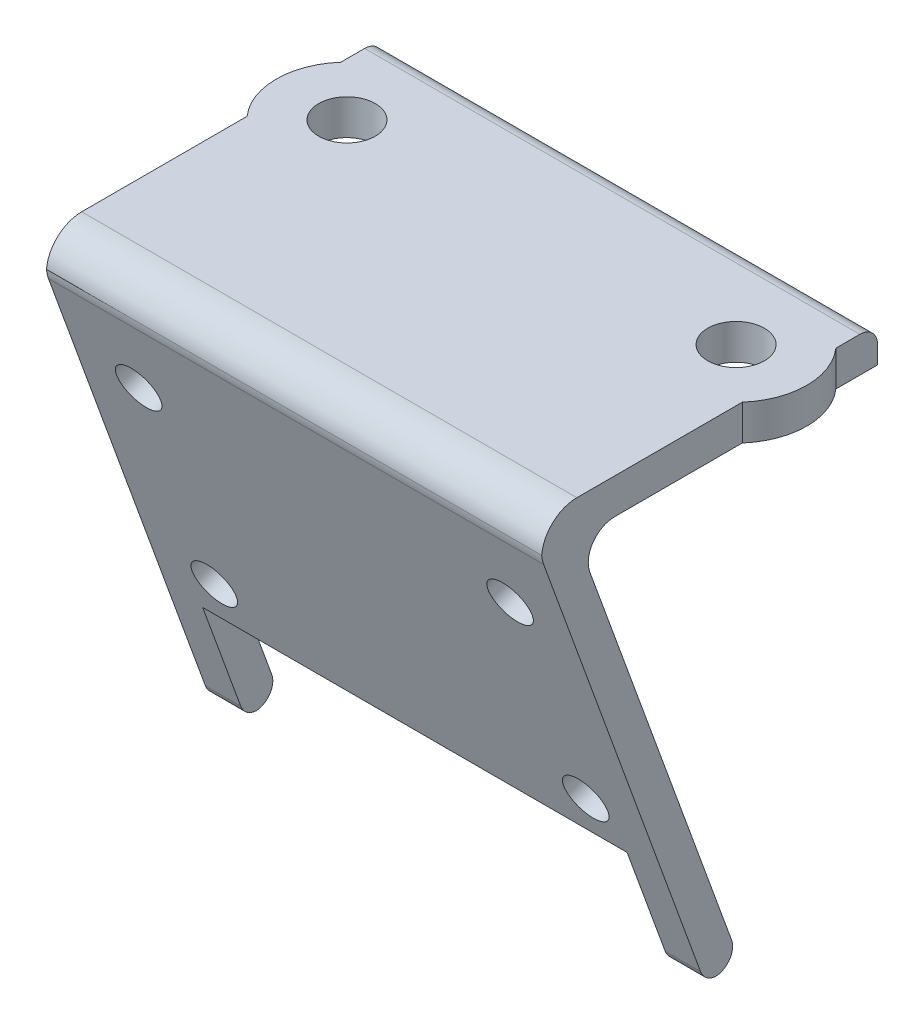
from build123d import *

# Parameters (mm, degrees)
SZKIC1_W                    = 28
SZKIC1_H                    = 19
DODANIE_WYCI_GNI_CIE1_DEPTH = 2
SZKIC2_R                    = 1.6
WYTNIJ_WYCI_GNI_CIE1_DEPTH  = 18.036725037
SZKIC7_R                    = 4
SZKIC7_R_2                  = 1.6
DODANIE_WYCI_GNI_CIE3_DEPTH = 2
DODANIE_WYCI_GNI_CIE2_DEPTH = 28
SZKIC4_R                    = 1.25
WYTNIJ_WYCI_GNI_CIE2_DEPTH  = 1.879385242
WYTNIJ_WYCI_GNI_CIE4_DEPTH  = 33.297362502
ZAOKR_GLENIE1_R             = 2
ZAOKR_GLENIE2_R             = 1.5
ZAOKR_GLENIE3_R             = 1
ZAOKR_GLENIE4_R             = 1


with BuildPart() as part:
    # Szkic1 → Dodanie-wyciągnięcie1 (new body)
    with BuildSketch(Plane(origin=(0, 0, 0), x_dir=(1, 0, 0), z_dir=(0, 1, 0))):
        Rectangle(SZKIC1_W, SZKIC1_H)
    extrude(amount=DODANIE_WYCI_GNI_CIE1_DEPTH)

    # Szkic2 → Wytnij-wyciągnięcie1 (cut, through all)
    with BuildSketch(Plane(origin=(0, 2, 0), x_dir=(1, 0, 0), z_dir=(0, 1, 0))):
        with Locations(Location((11, 4.5, 0), (0, 0, 270))):
            Circle(SZKIC2_R)
        with Locations(Location((-11, 4.5, 0), (0, 0, 90))):
            Circle(SZKIC2_R)
    extrude(amount=-WYTNIJ_WYCI_GNI_CIE1_DEPTH, mode=Mode.SUBTRACT)

    # Szkic7 → Dodanie-wyciągnięcie3 (add)
    with BuildSketch(Plane(origin=(0, 2, 0), x_dir=(1, 0, 0), z_dir=(0, 1, 0))):
        with Locations((11, 4.5)):
            Circle(SZKIC7_R)
        with Locations(Location((11, 4.5, 0), (0, 0, 270))):
            Circle(SZKIC7_R_2, mode=Mode.SUBTRACT)
    dodanie_wyci_gni_cie3 = extrude(amount=-DODANIE_WYCI_GNI_CIE3_DEPTH)

    # Lustro1: Dodanie-wyciągnięcie3 across plane
    add(dodanie_wyci_gni_cie3.mirror(Plane(origin=(0, 0, 0), x_dir=(0, 0, 1), z_dir=(1, 0, 0))))

    # Szkic3 → Dodanie-wyciągnięcie2 (add)
    with BuildSketch(Plane(origin=(14, 0, 0), x_dir=(0, 0, -1), z_dir=(1, 0, 0))):
        Polygon((-9.5, 0), (-0.26545613, -25.371700761), (1.73454387, -25.371700761), (-7.5, 0), align=None)
    extrude(amount=-DODANIE_WYCI_GNI_CIE2_DEPTH)

    # Szkic4 → Wytnij-wyciągnięcie2 (cut)
    with BuildSketch(Plane(origin=(0, -3.053241146, 8.388711105), x_dir=(1, 0, 0), z_dir=(0, -0.3420201433256705, 0.9396926207859079))):
        with Locations(Location((-10.5, -1.787484051, 0), (0, 0, 270))):
            Circle(SZKIC4_R)
        with Locations(Location((-10.5, -14.287484051, 0), (0, 0, 270))):
            Circle(SZKIC4_R)
        with Locations(Location((10.5, -14.287484051, 0), (0, 0, 90))):
            Circle(SZKIC4_R)
        with Locations(Location((10.5, -1.787484051, 0), (0, 0, 90))):
            Circle(SZKIC4_R)
    extrude(amount=-WYTNIJ_WYCI_GNI_CIE2_DEPTH, mode=Mode.SUBTRACT)

    # Szkic6 → Wytnij-wyciągnięcie4 (cut, through all)
    with BuildSketch(Plane(origin=(0, -3.053241146, 8.388711105), x_dir=(1, 0, 0), z_dir=(0, -0.3420201433256704, 0.9396926207859078))):
        Polygon((-12, -23.750808638), (-12, -16.750808638), (12, -16.750808638), (12, -23.750808638), (12, -25.909421261), (-12, -25.909421261), align=None)
    extrude(amount=-WYTNIJ_WYCI_GNI_CIE4_DEPTH, mode=Mode.SUBTRACT)

    # Zaokrąglenie1
    # the kernel refuses this fillet: 2 mm, written as the material it takes off along each edge
    with BuildSketch(Plane(origin=(-19, 2, 9.5), x_dir=(0, -1, 0), z_dir=(1, 0, 0))) as zaokr_glenie1_piece_1:
        with BuildLine():
            CenterArc((ZAOKR_GLENIE1_R, ZAOKR_GLENIE1_R), ZAOKR_GLENIE1_R, 180, 90)
            Line((0, ZAOKR_GLENIE1_R), (0, 0))
            Line((0, 0), (ZAOKR_GLENIE1_R, 0))
        make_face()
    extrude(amount=38, mode=Mode.SUBTRACT)
    with BuildSketch(Plane(origin=(-14.881634904, 0, 9.5), x_dir=(0, 1, 0), z_dir=(1, 0, 0))) as zaokr_glenie1_piece_2:
        with BuildLine():
            CenterArc((ZAOKR_GLENIE1_R * 0.176326980708, -ZAOKR_GLENIE1_R), ZAOKR_GLENIE1_R, 90, 20)
            Line((-ZAOKR_GLENIE1_R * 0.165693162617, -ZAOKR_GLENIE1_R * 0.0603073792141), (0, 0))
            Line((0, 0), (ZAOKR_GLENIE1_R * 0.176326980708, 0))
        make_face()
    extrude(amount=29.763269807, mode=Mode.SUBTRACT)

    # Zaokrąglenie2
    zaokr_glenie2_edges = [part.edges().sort_by_distance(p)[0] for p in [
        (0, 0, 7.5),
    ]]
    fillet(zaokr_glenie2_edges, radius=ZAOKR_GLENIE2_R)

    # Zaokrąglenie3
    # the kernel refuses this fillet: 1 mm, written as the material it takes off along each edge
    with BuildSketch(Plane(origin=(17.570370017, -25.371700761, -1.73454387), x_dir=(0, 0.9396926207859079, 0.34202014332567016), z_dir=(-1, 0, 0)), Plane(origin=(-8.429629983, -25.371700761, -1.73454387), x_dir=(0, 0.9396926207859079, 0.34202014332567016), z_dir=(-1, 0, 0))) as zaokr_glenie3_piece_1:
        with BuildLine():
            CenterArc((ZAOKR_GLENIE3_R * 1.42814800674, -ZAOKR_GLENIE3_R), ZAOKR_GLENIE3_R, 90, 110)
            Line((ZAOKR_GLENIE3_R * 0.488455385956, -ZAOKR_GLENIE3_R * 1.34202014333), (0, 0))
            Line((0, 0), (ZAOKR_GLENIE3_R * 1.42814800674, 0))
        make_face()
    extrude(amount=9.140740034, mode=Mode.SUBTRACT)
    with BuildSketch(Plane(origin=(-10.249481154, -25.371700761, 0.26545613), x_dir=(0, 0.9396926207859077, 0.34202014332567093), z_dir=(-1, 0, 0))) as zaokr_glenie3_piece_2:
        with BuildLine():
            CenterArc((ZAOKR_GLENIE3_R * 0.70020753821, ZAOKR_GLENIE3_R), ZAOKR_GLENIE3_R, 200, 70)
            Line((-ZAOKR_GLENIE3_R * 0.239485082576, ZAOKR_GLENIE3_R * 0.657979856674), (0, 0))
            Line((0, 0), (ZAOKR_GLENIE3_R * 0.70020753821, 0))
        make_face()
    extrude(amount=5.501037691, mode=Mode.SUBTRACT)
    with BuildSketch(Plane(origin=(15.750518846, -25.371700761, 0.26545613), x_dir=(0, 0, -1), z_dir=(-1, 0, 0))) as zaokr_glenie3_piece_3:
        with BuildLine():
            CenterArc((ZAOKR_GLENIE3_R * 0.70020753821, -ZAOKR_GLENIE3_R), ZAOKR_GLENIE3_R, 90, 70)
            Line((-ZAOKR_GLENIE3_R * 0.239485082576, -ZAOKR_GLENIE3_R * 0.657979856674), (0, 0))
            Line((0, 0), (ZAOKR_GLENIE3_R * 0.70020753821, 0))
        make_face()
    extrude(amount=5.501037691, mode=Mode.SUBTRACT)

    # Zaokrąglenie4
    zaokr_glenie4_edges = [part.edges().sort_by_distance(p)[0] for p in [
        (0, 2, -9.5),
    ]]
    fillet(zaokr_glenie4_edges, radius=ZAOKR_GLENIE4_R)


solid = part.part
